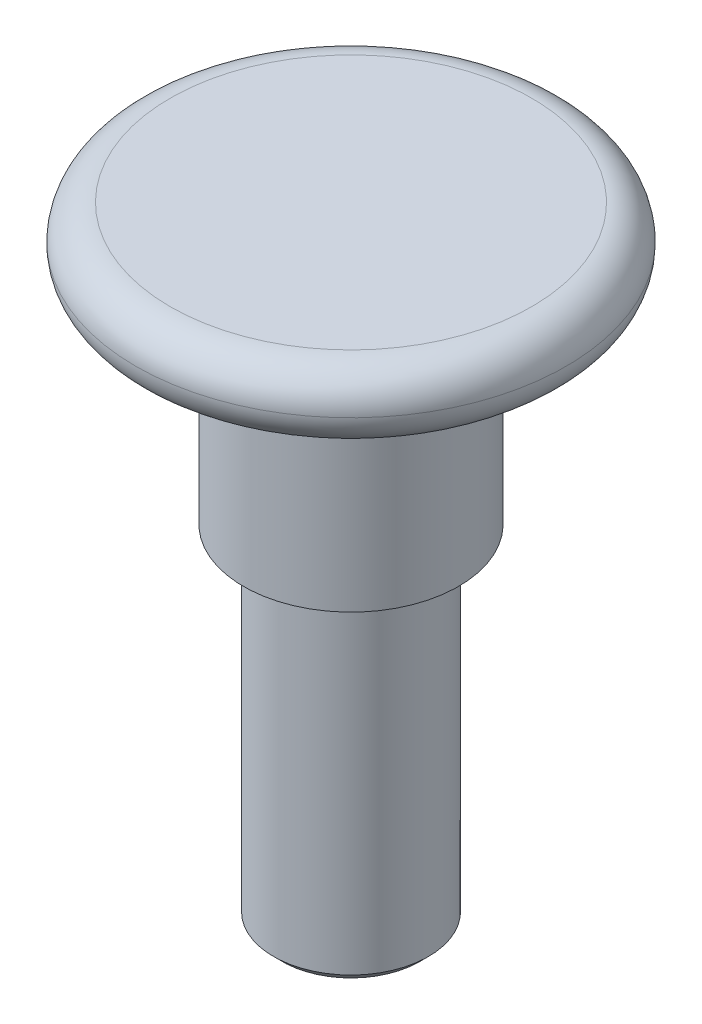
from build123d import *

# Parameters (mm, degrees)
FILETE1_R     = 2
CHANFRO1_SIZE = 0.5


with BuildPart() as part:
    # Esboço1 → Revolução1 (revolve)
    with BuildSketch(Plane.XY, mode=Mode.PRIVATE) as revolu_o1_sk:
        Polygon((0, 63.957087486), (12.5, 63.957087486), (12.5, 59.957087486), (6.25, 59.957087486), (6.25, 47.757087486), (4.5, 47.757087486), (4.5, 27.757087486), (0, 27.757087486), align=None)
    revolve(revolu_o1_sk.sketch.rotate(Axis((0, -74.716223699, 0), (0, 1, 0)), 90), axis=Axis((0, -74.716223699, 0), (0, 1, 0)))

    # Filete1
    filete1_edges = [part.edges().sort_by_distance(p)[0] for p in [
        (0, 59.957087486, 12.5),
        (0, 63.957087486, 12.5),
    ]]
    fillet(filete1_edges, radius=FILETE1_R - 0.0001)  # a hair under: the kernel refuses the full size

    # Chanfro1
    chanfro1_edges = [part.edges().sort_by_distance(p)[0] for p in [
        (0, 27.757087486, 4.5),
    ]]
    chamfer(chanfro1_edges, length=CHANFRO1_SIZE)


solid = part.part
